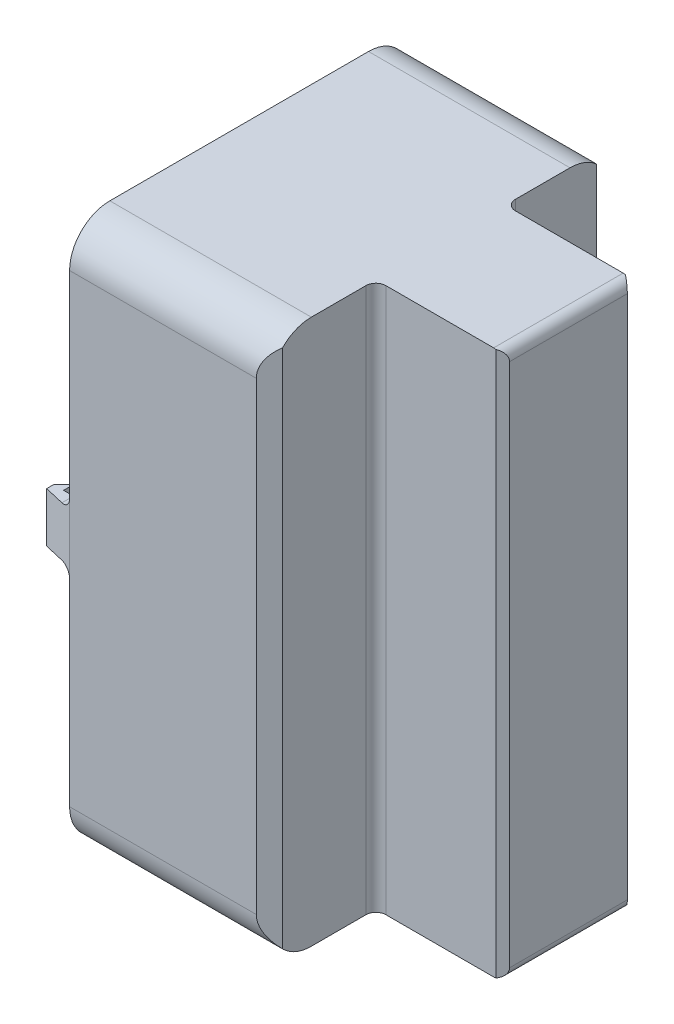
from build123d import *

# Parameters (mm, degrees)
BOSS_EXTRUDE2_DEPTH      = 13
BOSS_EXTRUDE2_DEPTH_BACK = 19.75
SKETCH2_W                = 39
SKETCH2_H                = 12
BOSS_EXTRUDE3_DEPTH      = 0.3
CUT_EXTRUDE1_DEPTH       = 19.727
CLIP_EDGE_DEPTH          = 2.5
FILLET1_R                = 1
CUT_EXTRUDE2_DEPTH       = 1382.6010589
FILLET2_R                = 1


with BuildPart() as part:
    # Sketch2 → Boss-Extrude2 (new, two sides: drawn at the far end of the back side and taken through both)
    with BuildSketch(Plane(origin=(0, 0, 0), x_dir=(0, -1, 0), z_dir=(1, 0, 0)).offset(-BOSS_EXTRUDE2_DEPTH_BACK)):
        with BuildLine():
            Line((-1027.172700071, 1376.290334899), (-1027.172700071, 1350.320334899))
            ThreePointArc((-1027.172700071, 1350.320334899), (-1025.989411467, 1347.463623503), (-1023.132700071, 1346.280334899))
            Line((-1023.132700071, 1346.280334899), (-976.512700071, 1346.280334899))
            ThreePointArc((-976.512700071, 1346.280334899), (-973.655988675, 1347.463623503), (-972.472700071, 1350.320334899))
            Line((-972.472700071, 1350.320334899), (-972.472700071, 1376.290334899))
            ThreePointArc((-972.472700071, 1376.290334899), (-973.655988675, 1379.147046295), (-976.512700071, 1380.330334899))
            Line((-976.512700071, 1380.330334899), (-1023.132700071, 1380.330334899))
            ThreePointArc((-1023.132700071, 1380.330334899), (-1025.989411467, 1379.147046295), (-1027.172700071, 1376.290334899))
        make_face()
        with Locations((-999.822700071, 1363.305334899)):
            Rectangle(SKETCH2_W, SKETCH2_H, mode=Mode.SUBTRACT)
    extrude(amount=BOSS_EXTRUDE2_DEPTH + BOSS_EXTRUDE2_DEPTH_BACK)

    # Sketch3 → Boss-Extrude3 (add)
    with BuildSketch(Plane.YZ.offset(13)):
        with BuildLine():
            Line((972.472700071, -1350.320334899), (972.472700071, -1376.290334899))
            ThreePointArc((972.472700071, -1376.290334899), (973.655988675, -1379.147046295), (976.512700071, -1380.330334899))
            Line((976.512700071, -1380.330334899), (1023.132700071, -1380.330334899))
            ThreePointArc((1023.132700071, -1380.330334899), (1025.989411467, -1379.147046295), (1027.172700071, -1376.290334899))
            Line((1027.172700071, -1376.290334899), (1027.172700071, -1350.320334899))
            ThreePointArc((1027.172700071, -1350.320334899), (1025.989411467, -1347.463623503), (1023.132700071, -1346.280334899))
            Line((1023.132700071, -1346.280334899), (976.512700071, -1346.280334899))
            ThreePointArc((976.512700071, -1346.280334899), (973.655988675, -1347.463623503), (972.472700071, -1350.320334899))
        make_face()
    extrude(amount=BOSS_EXTRUDE3_DEPTH)

    # Sketch6 → Cut-Extrude1 (cut)
    with BuildSketch(Plane(origin=(-19.75, 0, 0), x_dir=(0, -1, 0), z_dir=(-1, 0, 0))):
        with BuildLine():
            Line((-1025.772700071, -1350.320334899), (-1025.772700071, -1376.290334899))
            ThreePointArc((-1025.772700071, -1376.290334899), (-1024.999461974, -1378.157096801), (-1023.132700071, -1378.930334899))
            Line((-1023.132700071, -1378.930334899), (-976.512700071, -1378.930334899))
            ThreePointArc((-976.512700071, -1378.930334899), (-974.645938169, -1378.157096801), (-973.872700071, -1376.290334899))
            Line((-973.872700071, -1376.290334899), (-973.872700071, -1350.320334899))
            ThreePointArc((-973.872700071, -1350.320334899), (-974.645938169, -1348.453572996), (-976.512700071, -1347.680334899))
            Line((-976.512700071, -1347.680334899), (-1023.132700071, -1347.680334899))
            ThreePointArc((-1023.132700071, -1347.680334899), (-1024.999461974, -1348.453572996), (-1025.772700071, -1350.320334899))
        make_face()
    extrude(amount=-CUT_EXTRUDE1_DEPTH, mode=Mode.SUBTRACT)

    # Sketch10 → Clip Edge (add, symmetric)
    with BuildSketch(Plane(origin=(0, 999.822700071, 0), x_dir=(-1, 0, 0), z_dir=(0, -1, 0))):
        Polygon((19.75, 1346.280334899), (19.75, 1347.680334899), (21.75, 1347.680334899), (21.75, 1348.680334899), (22.75, 1347.680334899), (22.75, 1346.980334899), align=None)
    clip_edge = extrude(amount=CLIP_EDGE_DEPTH, both=True)

    # Mirror1: Clip Edge across plane
    add(clip_edge.mirror(Plane(origin=(0, 0, -1363.305334899), x_dir=(1, 0, 0), z_dir=(0, 0, -1))))

    # Fillet1
    # the kernel refuses this fillet: 1 mm, written as the material it adds along each edge
    with BuildSketch(Plane(origin=(-19.75, 1002.322700071, -1346.280334899), x_dir=(0, 1, 0), z_dir=(0, 0, -1))) as fillet1_piece_1_section:
        with BuildLine():
            CenterArc((FILLET1_R, -FILLET1_R), FILLET1_R, 90, 90)
            Line((0, -FILLET1_R), (0, 0))
            Line((0, 0), (FILLET1_R, 0))
        make_face()
    fillet1_piece_1 = extrude(amount=1.4, mode=Mode.PRIVATE)
    fillet1_piece_1 = split(fillet1_piece_1, bisect_by=Plane(origin=(-20.117660962, 1002.553814872, -1346.366122456), z_dir=(0.22722961560622243, 0, -0.973841209741839)), keep=Keep.TOP, mode=Mode.PRIVATE)
    add(fillet1_piece_1)
    with BuildSketch(Plane(origin=(-19.75, 997.322700071, -1346.280334899), x_dir=(0, -1, 0), z_dir=(0, 0, -1))) as fillet1_piece_2_section:
        with BuildLine():
            CenterArc((FILLET1_R, FILLET1_R), FILLET1_R, 180, 90)
            Line((0, FILLET1_R), (0, 0))
            Line((0, 0), (FILLET1_R, 0))
        make_face()
    fillet1_piece_2 = extrude(amount=1.4, mode=Mode.PRIVATE)
    fillet1_piece_2 = split(fillet1_piece_2, bisect_by=Plane(origin=(-20.117660962, 997.091585271, -1346.366122456), z_dir=(0.22722961560622243, 0, -0.973841209741839)), keep=Keep.TOP, mode=Mode.PRIVATE)
    add(fillet1_piece_2)
    with BuildSketch(Plane(origin=(-19.75, 997.322700071, -1380.330334899), x_dir=(0, -1, 0), z_dir=(0, 0, 1))) as fillet1_piece_3_section:
        with BuildLine():
            CenterArc((FILLET1_R, -FILLET1_R), FILLET1_R, 90, 90)
            Line((0, -FILLET1_R), (0, 0))
            Line((0, 0), (FILLET1_R, 0))
        make_face()
    fillet1_piece_3 = extrude(amount=1.4, mode=Mode.PRIVATE)
    fillet1_piece_3 = split(fillet1_piece_3, bisect_by=Plane(origin=(-20.117660962, 997.091585271, -1380.244547341), z_dir=(0.22722961560622243, 0, 0.973841209741839)), keep=Keep.TOP, mode=Mode.PRIVATE)
    add(fillet1_piece_3)
    with BuildSketch(Plane(origin=(-19.75, 1002.322700071, -1380.330334899), x_dir=(0, 1, 0), z_dir=(0, 0, 1))) as fillet1_piece_4_section:
        with BuildLine():
            CenterArc((FILLET1_R, FILLET1_R), FILLET1_R, 180, 90)
            Line((0, FILLET1_R), (0, 0))
            Line((0, 0), (FILLET1_R, 0))
        make_face()
    fillet1_piece_4 = extrude(amount=1.4, mode=Mode.PRIVATE)
    fillet1_piece_4 = split(fillet1_piece_4, bisect_by=Plane(origin=(-20.117660962, 1002.553814872, -1380.244547341), z_dir=(0.22722961560622243, 0, 0.973841209741839)), keep=Keep.TOP, mode=Mode.PRIVATE)
    add(fillet1_piece_4)
    with BuildSketch(Plane(origin=(13, 1021.822700071, -1369.305334899), x_dir=(-1, 0, 0), z_dir=(0, -1, 0)), Plane(origin=(13, 977.822700071, -1357.305334899), x_dir=(-1, 0, 0), z_dir=(0, 1, 0))) as fillet1_piece_5:
        with BuildLine():
            CenterArc((FILLET1_R, -FILLET1_R), FILLET1_R, 90, 90)
            Line((0, -FILLET1_R), (0, 0))
            Line((0, 0), (FILLET1_R, 0))
        make_face()
    extrude(amount=44)
    with BuildSketch(Plane(origin=(13, 1019.322700071, -1354.805334899), x_dir=(-1, 0, 0), z_dir=(0, 0, -1)), Plane(origin=(13, 980.322700071, -1371.805334899), x_dir=(-1, 0, 0), z_dir=(0, 0, 1))) as fillet1_piece_6:
        with BuildLine():
            CenterArc((FILLET1_R, -FILLET1_R), FILLET1_R, 90, 90)
            Line((0, -FILLET1_R), (0, 0))
            Line((0, 0), (FILLET1_R, 0))
        make_face()
    extrude(amount=17)
    # the kernel refuses this fillet: 1 mm, written as the material it takes off along each edge
    with BuildSketch(Plane(origin=(13.3, 976.512700071, -1350.320334899), x_dir=(0, 0, 1), z_dir=(0, 1, 0))) as fillet1_2_piece_1:
        with BuildLine():
            CenterArc((4.04 - FILLET1_R, -FILLET1_R), FILLET1_R, 0, 90)
            Line((4.04 - FILLET1_R, 0), (4.04, 0))
            Line((4.04, 0), (4.04, -FILLET1_R))
        make_face()
    revolve(axis=Axis((13.3, 976.512700071, -1350.320334899), (1, 0, 0)), revolution_arc=90, mode=Mode.SUBTRACT)
    with BuildSketch(Plane(origin=(13.3, 972.472700071, -1350.320334899), x_dir=(-1, 0, 0), z_dir=(0, 0, -1)), Plane(origin=(13.3, 1027.172700071, -1376.290334899), x_dir=(-1, 0, 0), z_dir=(0, 0, 1))) as fillet1_2_piece_2:
        with BuildLine():
            CenterArc((FILLET1_R, FILLET1_R), FILLET1_R, 180, 90)
            Line((0, FILLET1_R), (0, 0))
            Line((0, 0), (FILLET1_R, 0))
        make_face()
    extrude(amount=25.97, mode=Mode.SUBTRACT)
    with BuildSketch(Plane(origin=(13.3, 976.512700071, -1376.290334899), x_dir=(0, -1, 0), z_dir=(0, 0, 1))) as fillet1_2_piece_3:
        with BuildLine():
            CenterArc((4.04 - FILLET1_R, -FILLET1_R), FILLET1_R, 0, 90)
            Line((4.04 - FILLET1_R, 0), (4.04, 0))
            Line((4.04, 0), (4.04, -FILLET1_R))
        make_face()
    revolve(axis=Axis((13.3, 976.512700071, -1376.290334899), (1, 0, 0)), revolution_arc=90, mode=Mode.SUBTRACT)
    with BuildSketch(Plane(origin=(13.3, 976.512700071, -1380.330334899), x_dir=(-1, 0, 0), z_dir=(0, 1, 0)), Plane(origin=(13.3, 1023.132700071, -1346.280334899), x_dir=(-1, 0, 0), z_dir=(0, -1, 0))) as fillet1_2_piece_4:
        with BuildLine():
            CenterArc((FILLET1_R, FILLET1_R), FILLET1_R, 180, 90)
            Line((0, FILLET1_R), (0, 0))
            Line((0, 0), (FILLET1_R, 0))
        make_face()
    extrude(amount=46.62, mode=Mode.SUBTRACT)
    with BuildSketch(Plane(origin=(13.3, 1023.132700071, -1376.290334899), x_dir=(0, 0, -1), z_dir=(0, -1, 0))) as fillet1_2_piece_5:
        with BuildLine():
            CenterArc((4.04 - FILLET1_R, -FILLET1_R), FILLET1_R, 0, 90)
            Line((4.04, -FILLET1_R), (4.04, 0))
            Line((4.04, 0), (4.04 - FILLET1_R, 0))
        make_face()
    revolve(axis=Axis((13.3, 1023.132700071, -1376.290334899), (1, 0, 0)), revolution_arc=90, mode=Mode.SUBTRACT)
    with BuildSketch(Plane(origin=(13.3, 1023.132700071, -1350.320334899), x_dir=(0, 1, 0), z_dir=(0, 0, -1))) as fillet1_2_piece_6:
        with BuildLine():
            CenterArc((4.04 - FILLET1_R, -FILLET1_R), FILLET1_R, 0, 90)
            Line((4.04 - FILLET1_R, 0), (4.04, 0))
            Line((4.04, 0), (4.04, -FILLET1_R))
        make_face()
    revolve(axis=Axis((13.3, 1023.132700071, -1350.320334899), (1, 0, 0)), revolution_arc=90, mode=Mode.SUBTRACT)
    with BuildSketch(Plane(origin=(-0.023, 1019.322700071, -1369.305334899), x_dir=(0, 1, 0), z_dir=(0, 0, 1)), Plane(origin=(-0.023, 980.322700071, -1357.305334899), x_dir=(0, -1, 0), z_dir=(0, 0, -1))) as fillet1_2_piece_7:
        with BuildLine():
            CenterArc((FILLET1_R, -FILLET1_R), FILLET1_R, 90, 90)
            Line((0, -FILLET1_R), (0, 0))
            Line((0, 0), (FILLET1_R, 0))
        make_face()
    extrude(amount=12, mode=Mode.SUBTRACT)
    with BuildSketch(Plane(origin=(-0.023, 980.322700071, -1369.305334899), x_dir=(0, 0, -1), z_dir=(0, 1, 0)), Plane(origin=(-0.023, 1019.322700071, -1357.305334899), x_dir=(0, 0, 1), z_dir=(0, -1, 0))) as fillet1_2_piece_8:
        with BuildLine():
            CenterArc((FILLET1_R, -FILLET1_R), FILLET1_R, 90, 90)
            Line((0, -FILLET1_R), (0, 0))
            Line((0, 0), (FILLET1_R, 0))
        make_face()
    extrude(amount=39, mode=Mode.SUBTRACT)
    with BuildSketch(Plane(origin=(-0.023, 1019.322700071, -1371.805334899), x_dir=(0, 1, 0), z_dir=(0, 0, 1))) as fillet1_2_piece_9a_section:
        with BuildLine():
            CenterArc((FILLET1_R, -FILLET1_R), FILLET1_R, 90, 90)
            Line((0, -FILLET1_R), (0, 0))
            Line((0, 0), (FILLET1_R, 0))
        make_face()
    fillet1_2_piece_9a = extrude(amount=14.5, mode=Mode.PRIVATE)
    fillet1_2_piece_9a = split(fillet1_2_piece_9a, bisect_by=Plane(origin=(0.203395114, 1019.549095185, -1369.305334899), z_dir=(0, 0, -1)), keep=Keep.TOP, mode=Mode.PRIVATE)
    with BuildSketch(Plane(origin=(-0.023, 980.322700071, -1369.305334899), x_dir=(0, 0, -1), z_dir=(0, 1, 0))) as fillet1_2_piece_9b_section:
        with BuildLine():
            CenterArc((FILLET1_R, -FILLET1_R), FILLET1_R, 90, 90)
            Line((0, -FILLET1_R), (0, 0))
            Line((0, 0), (FILLET1_R, 0))
        make_face()
    fillet1_2_piece_9b = extrude(amount=41.5, mode=Mode.PRIVATE)
    fillet1_2_piece_9b = split(fillet1_2_piece_9b, bisect_by=Plane(origin=(0.203395114, 1019.322700071, -1369.531730013), z_dir=(0, 1, 0)), keep=Keep.TOP, mode=Mode.PRIVATE)
    fillet1_2_piece_9 = fillet1_2_piece_9a & fillet1_2_piece_9b
    add(fillet1_2_piece_9, mode=Mode.SUBTRACT)
    with BuildSketch(Plane(origin=(-0.023, 1021.822700071, -1357.305334899), x_dir=(0, 0, 1), z_dir=(0, -1, 0))) as fillet1_2_piece_10a_section:
        with BuildLine():
            CenterArc((FILLET1_R, -FILLET1_R), FILLET1_R, 90, 90)
            Line((0, -FILLET1_R), (0, 0))
            Line((0, 0), (FILLET1_R, 0))
        make_face()
    fillet1_2_piece_10a = extrude(amount=41.5, mode=Mode.PRIVATE)
    fillet1_2_piece_10a = split(fillet1_2_piece_10a, bisect_by=Plane(origin=(0.203395114, 1019.322700071, -1357.078939784), z_dir=(0, 1, 0)), keep=Keep.TOP, mode=Mode.PRIVATE)
    with BuildSketch(Plane(origin=(-0.023, 1019.322700071, -1369.305334899), x_dir=(0, 1, 0), z_dir=(0, 0, 1))) as fillet1_2_piece_10b_section:
        with BuildLine():
            CenterArc((FILLET1_R, -FILLET1_R), FILLET1_R, 90, 90)
            Line((0, -FILLET1_R), (0, 0))
            Line((0, 0), (FILLET1_R, 0))
        make_face()
    fillet1_2_piece_10b = extrude(amount=14.5, mode=Mode.PRIVATE)
    fillet1_2_piece_10b = split(fillet1_2_piece_10b, bisect_by=Plane(origin=(0.203395114, 1019.549095185, -1357.305334899), z_dir=(0, 0, 1)), keep=Keep.TOP, mode=Mode.PRIVATE)
    fillet1_2_piece_10 = fillet1_2_piece_10a & fillet1_2_piece_10b
    add(fillet1_2_piece_10, mode=Mode.SUBTRACT)
    with BuildSketch(Plane(origin=(-0.023, 980.322700071, -1357.305334899), x_dir=(0, -1, 0), z_dir=(0, 0, -1))) as fillet1_2_piece_11a_section:
        with BuildLine():
            CenterArc((FILLET1_R, -FILLET1_R), FILLET1_R, 90, 90)
            Line((0, -FILLET1_R), (0, 0))
            Line((0, 0), (FILLET1_R, 0))
        make_face()
    fillet1_2_piece_11a = extrude(amount=14.5, mode=Mode.PRIVATE)
    fillet1_2_piece_11a = split(fillet1_2_piece_11a, bisect_by=Plane(origin=(0.203395114, 980.096304957, -1369.305334899), z_dir=(0, 0, -1)), keep=Keep.TOP, mode=Mode.PRIVATE)
    with BuildSketch(Plane(origin=(-0.023, 977.822700071, -1369.305334899), x_dir=(0, 0, -1), z_dir=(0, 1, 0))) as fillet1_2_piece_11b_section:
        with BuildLine():
            CenterArc((FILLET1_R, -FILLET1_R), FILLET1_R, 90, 90)
            Line((0, -FILLET1_R), (0, 0))
            Line((0, 0), (FILLET1_R, 0))
        make_face()
    fillet1_2_piece_11b = extrude(amount=41.5, mode=Mode.PRIVATE)
    fillet1_2_piece_11b = split(fillet1_2_piece_11b, bisect_by=Plane(origin=(0.203395114, 980.322700071, -1369.531730013), z_dir=(0, -1, 0)), keep=Keep.TOP, mode=Mode.PRIVATE)
    fillet1_2_piece_11 = fillet1_2_piece_11a & fillet1_2_piece_11b
    add(fillet1_2_piece_11, mode=Mode.SUBTRACT)
    with BuildSketch(Plane(origin=(-0.023, 980.322700071, -1354.805334899), x_dir=(0, -1, 0), z_dir=(0, 0, -1))) as fillet1_2_piece_12a_section:
        with BuildLine():
            CenterArc((FILLET1_R, -FILLET1_R), FILLET1_R, 90, 90)
            Line((0, -FILLET1_R), (0, 0))
            Line((0, 0), (FILLET1_R, 0))
        make_face()
    fillet1_2_piece_12a = extrude(amount=14.5, mode=Mode.PRIVATE)
    fillet1_2_piece_12a = split(fillet1_2_piece_12a, bisect_by=Plane(origin=(0.203395114, 980.096304957, -1357.305334899), z_dir=(0, 0, 1)), keep=Keep.TOP, mode=Mode.PRIVATE)
    with BuildSketch(Plane(origin=(-0.023, 1019.322700071, -1357.305334899), x_dir=(0, 0, 1), z_dir=(0, -1, 0))) as fillet1_2_piece_12b_section:
        with BuildLine():
            CenterArc((FILLET1_R, -FILLET1_R), FILLET1_R, 90, 90)
            Line((0, -FILLET1_R), (0, 0))
            Line((0, 0), (FILLET1_R, 0))
        make_face()
    fillet1_2_piece_12b = extrude(amount=41.5, mode=Mode.PRIVATE)
    fillet1_2_piece_12b = split(fillet1_2_piece_12b, bisect_by=Plane(origin=(0.203395114, 980.322700071, -1357.078939784), z_dir=(0, -1, 0)), keep=Keep.TOP, mode=Mode.PRIVATE)
    fillet1_2_piece_12 = fillet1_2_piece_12a & fillet1_2_piece_12b
    add(fillet1_2_piece_12, mode=Mode.SUBTRACT)

    # Sketch11 → Cut-Extrude2 (cut, through all)
    with BuildSketch(Plane(origin=(0, 1027.172700071, 0), x_dir=(-1, 0, 0), z_dir=(0, 1, 0))):
        with BuildLine():
            Line((-13.3, -1357.401935688), (-13.3, -1350.320334899))
            Line((-13.3, -1350.320334899), (-13.3, -1347.280334899))
            ThreePointArc((-13.3, -1347.280334899), (-13.007106781, -1346.573228118), (-12.3, -1346.280334899))
            Line((-12.3, -1346.280334899), (1.007680047, -1346.280334899))
            Line((1.007680047, -1346.280334899), (-0.477, -1347.434401717))
            Line((-0.477, -1347.434401717), (-0.477, -1356.805334899))
            Line((-0.477, -1356.805334899), (-12.532486997, -1356.805334899))
            Line((-12.532486997, -1356.805334899), (-13.3, -1357.401935688))
        make_face()
        with BuildLine():
            Line((-12.532486997, -1369.805334899), (-0.477, -1369.805334899))
            Line((-0.477, -1369.805334899), (-0.477, -1378.965184901))
            Line((-0.477, -1378.965184901), (1.319704973, -1380.330334899))
            Line((1.319704973, -1380.330334899), (-12.3, -1380.330334899))
            ThreePointArc((-12.3, -1380.330334899), (-13.007106781, -1380.03744168), (-13.3, -1379.330334899))
            Line((-13.3, -1379.330334899), (-13.3, -1369.222172727))
            Line((-13.3, -1369.222172727), (-12.532486997, -1369.805334899))
        make_face()
    extrude(amount=-CUT_EXTRUDE2_DEPTH, mode=Mode.SUBTRACT)

    # Fillet2
    fillet2_edges = [part.edges().sort_by_distance(p)[0] for p in [
        (0.477, 999.822700071, -1369.805334899),
        (0.477, 999.822700071, -1356.805334899),
    ]]
    fillet(fillet2_edges, radius=FILLET2_R)


solid = part.part
